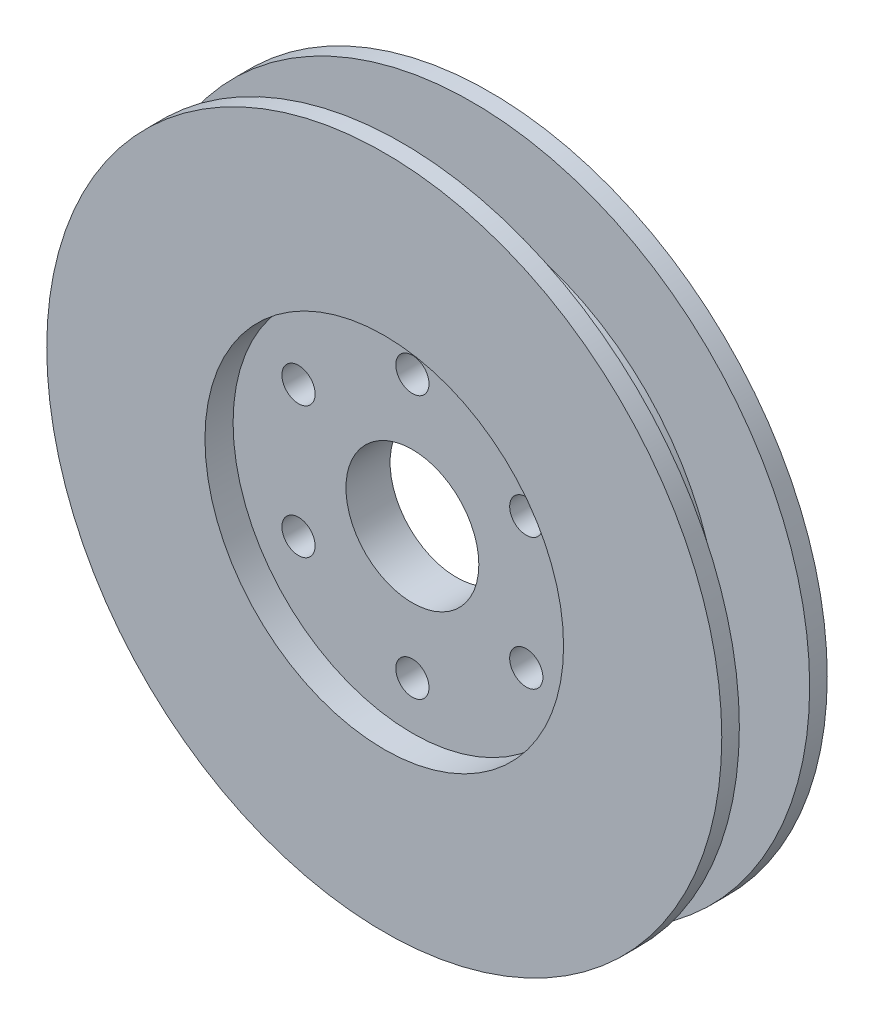
from build123d import *

# Parameters (mm, degrees)
SKETCH1_R             = 60.96
BOSS_EXTRUDE1_DEPTH   = 19.05
SKETCH2_R             = 12
CUT_EXTRUDE1_DEPTH    = 89.290122324
SKETCH3_R             = 32.385
CUT_EXTRUDE2_DEPTH    = 5.08
SKETCH4_R             = 28.4
CUT_EXTRUDE3_DEPTH    = 6
F_6_0MM_DOWEL_HOLE1_D = 6


with BuildPart() as part:
    # Sketch1 → Boss-Extrude1 (new body)
    with BuildSketch(Plane.XY):
        Circle(SKETCH1_R)
    extrude(amount=BOSS_EXTRUDE1_DEPTH)

    # Sketch2 → Cut-Extrude1 (cut, through all)
    with BuildSketch(Plane.XY.offset(19.05)):
        Circle(SKETCH2_R)
    extrude(amount=-CUT_EXTRUDE1_DEPTH, mode=Mode.SUBTRACT)

    # Sketch3 → Cut-Extrude2 (cut)
    with BuildSketch(Plane.XY.offset(19.05)):
        Circle(SKETCH3_R)
    extrude(amount=-CUT_EXTRUDE2_DEPTH, mode=Mode.SUBTRACT)

    # Sketch4 → Cut-Extrude3 (cut)
    with BuildSketch(Plane(origin=(0, 0, 0), x_dir=(-1, 0, 0), z_dir=(0, 0, -1))):
        Circle(SKETCH4_R)
    extrude(amount=-CUT_EXTRUDE3_DEPTH, mode=Mode.SUBTRACT)

    # Ø6.0mm Dowel Hole1 (through all)
    with Locations(Plane(origin=(0, 0, 6), x_dir=(-1, 0, 0), z_dir=(0, 0, -1))):
        with Locations((0, 23.75), (20.56810334, 11.875), (20.56810334, -11.875), (0, -23.75), (-20.56810334, 11.875), (-20.56810334, -11.875)):
            Hole(F_6_0MM_DOWEL_HOLE1_D / 2)

    # Sketch12 → Cut-Revolve1 (revolve, cut)
    with BuildSketch(Plane(origin=(0, 0, 0), x_dir=(0, 0, -1), z_dir=(1, 0, 0))):
        Polygon((-3.175, 63.5), (-15.875, 63.5), (-15.875, 50.8), (-15.875, 44.45), (-3.175, 44.45), (-3.175, 50.8), align=None)
    revolve(axis=Axis((0, 0, 0), (0, 0, 1)), mode=Mode.SUBTRACT)


solid = part.part
